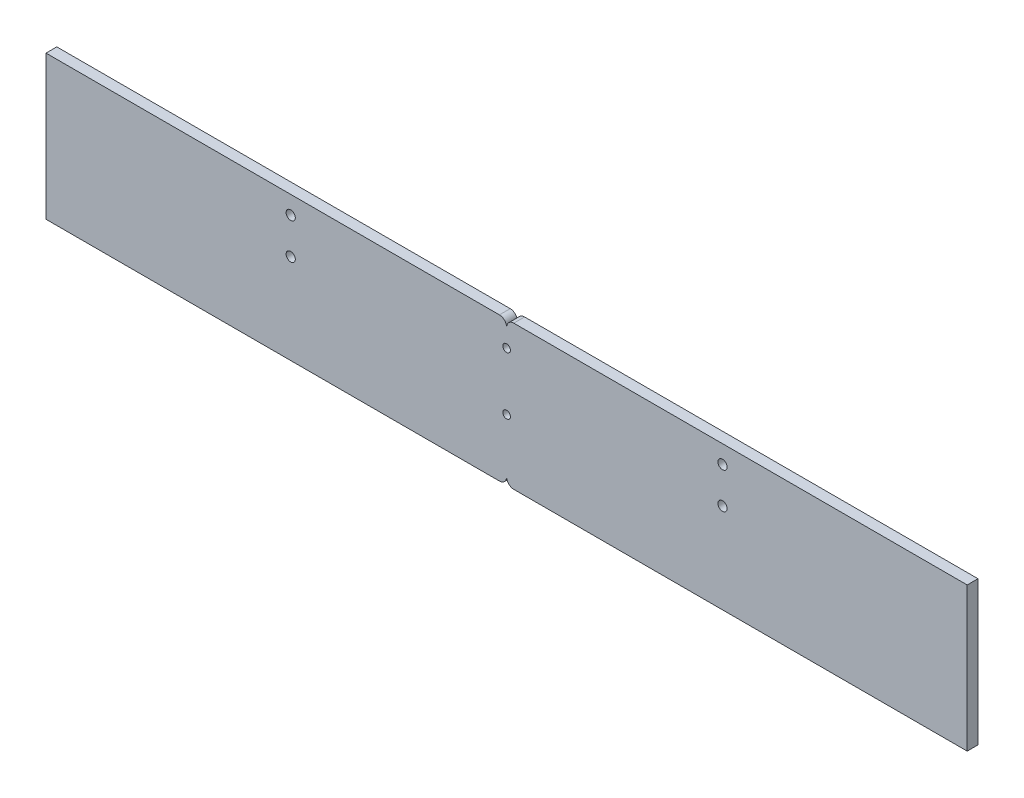
from build123d import *

# Parameters (mm, degrees)
SKETCH_1_W          = 512
SKETCH_1_H          = 80
EXTRUDE_1_DEPTH     = 6
SKETCH_2_R          = 2.1
SKETCH_2_R_2        = 2.55
CUT_EXTRUDE_1_DEPTH = 568.398840135


with BuildPart() as part:
    # Эскиз1 → Бобышка-Вытянуть1 (new body)
    with BuildSketch(Plane.XY):
        with Locations((256, -204.461538462)):
            Rectangle(SKETCH_1_W, SKETCH_1_H)
    extrude(amount=EXTRUDE_1_DEPTH)

    # Эскиз2 → Вырез-Вытянуть1 (cut, through all)
    with BuildSketch(Plane.XY.offset(6)):
        with Locations((256, -178.461538462)):
            Circle(SKETCH_2_R)
        with Locations((256, -210.461538462)):
            Circle(SKETCH_2_R)
        with Locations((136, -174.461538462)):
            Circle(SKETCH_2_R_2)
        with Locations((136, -194.461538462)):
            Circle(SKETCH_2_R_2)
        with Locations((376, -174.461538462)):
            Circle(SKETCH_2_R_2)
        with Locations((376, -194.461538462)):
            Circle(SKETCH_2_R_2)
        with BuildLine():
            Line((259.98727413, -244.461538462), (252.01272587, -244.461538462))
            ThreePointArc((252.01272587, -244.461538462), (254.832154446, -243.293692907), (256, -240.474264331))
            ThreePointArc((256, -240.474264331), (257.167845554, -243.293692907), (259.98727413, -244.461538462))
        make_face()
        with BuildLine():
            Line((259.98727413, -164.461538462), (252.01272587, -164.461538462))
            ThreePointArc((252.01272587, -164.461538462), (254.832154446, -165.629384016), (256, -168.448812592))
            ThreePointArc((256, -168.448812592), (257.167845554, -165.629384016), (259.98727413, -164.461538462))
        make_face()
    extrude(amount=-CUT_EXTRUDE_1_DEPTH, mode=Mode.SUBTRACT)


solid = part.part
